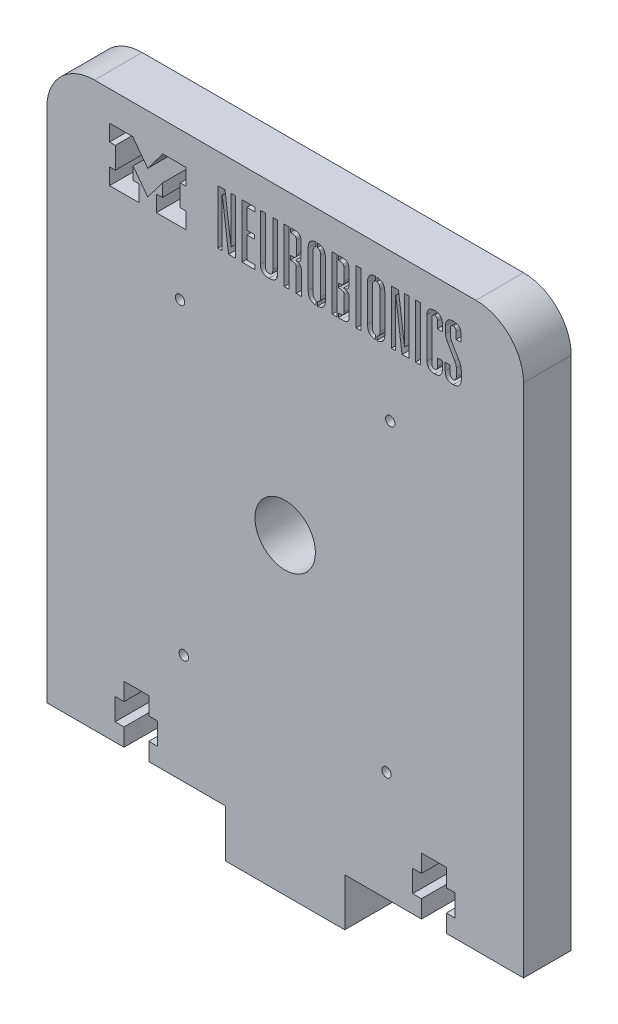
from build123d import *

# Parameters (mm, degrees)
SKETCH1_W             = 127
SKETCH1_H             = 150
BOSS_EXTRUDE1_DEPTH   = 12.7
CUT_EXTRUDE1_DEPTH    = 197.952506966
FILLET1_R             = 12.7
SKETCH11_W            = 31.75
SKETCH11_H            = 12.7
BOSS_EXTRUDE2_DEPTH   = 12.7
CUT_EXTRUDE9_DEPTH    = 197.952506966
SKETCH19_W            = 1.320165
SKETCH19_H            = 14.40446524
CUT_EXTRUDE10_DEPTH   = 197.952506966
SKETCH21_R            = 8.05
CUT_EXTRUDE11_DEPTH   = 197.952507113
M3X0_5_TAPPED_HOLE1_D = 2.5
FILLET2_R             = 0.25


with BuildPart() as part:
    # Sketch1 → Boss-Extrude1 (new body)
    with BuildSketch(Plane.XY):
        with Locations((63.5, 75)):
            Rectangle(SKETCH1_W, SKETCH1_H)
    extrude(amount=BOSS_EXTRUDE1_DEPTH)

    # Sketch2 → Cut-Extrude1 (cut, through all)
    with BuildSketch(Plane.XY.offset(12.7)):
        Polygon((20.574, 4.699), (20.574, 0), (27.178, 0), (27.178, 4.699), (29.5402, 4.699), (29.5402, 10.541), (27.178, 10.541), (27.178, 15.24), (20.574, 15.24), (20.574, 10.541), (18.2118, 10.541), (18.2118, 4.699), align=None)
        Polygon((99.822, 4.699), (99.822, 0), (106.426, 0), (106.426, 4.699), (108.7882, 4.699), (108.7882, 10.541), (106.426, 10.541), (106.426, 15.24), (99.822, 15.24), (99.822, 10.541), (97.4598, 10.541), (97.4598, 4.699), align=None)
    extrude(amount=-CUT_EXTRUDE1_DEPTH, mode=Mode.SUBTRACT)

    # Fillet1
    fillet1_edges = [part.edges().sort_by_distance(p)[0] for p in [
        (127, 150, 6.35),
        (0, 150, 6.35),
    ]]
    fillet(fillet1_edges, radius=FILLET1_R)

    # Sketch11 → Boss-Extrude2 (add)
    with BuildSketch(Plane.XZ):
        with Locations((63.5, 6.35)):
            Rectangle(SKETCH11_W, SKETCH11_H)
    extrude(amount=BOSS_EXTRUDE2_DEPTH)

    # Sketch20 → Cut-Extrude9 (cut, through all)
    with BuildSketch(Plane.XY.offset(12.7)):
        Polygon((22.97667018, 131.97336552), (24.604291259, 131.97336552), (24.604291259, 127.640619868), (16.714850296, 127.640619868), (16.714850296, 131.97336552), (18.254329992, 131.97336552), (18.254329992, 137.700621193), (16.714056676, 137.700621193), (16.714056676, 142.045085108), (22.890341603, 142.045085108), (26.901674355, 136.730226684), (30.913007108, 142.045085108), (37.089292035, 142.045085108), (37.089292035, 137.700621193), (35.549018719, 137.700621193), (35.549018719, 131.97336552), (37.088498415, 131.97336552), (37.088498415, 127.640619868), (29.199057452, 127.640619868), (29.199057452, 131.97336552), (30.826678531, 131.97336552), (30.826678531, 135.321098969), (26.901674355, 130.12062252), (22.97667018, 135.321098969), align=None)
    extrude(amount=-CUT_EXTRUDE9_DEPTH, mode=Mode.SUBTRACT)

    # Sketch19 → Cut-Extrude10 (cut, through all)
    with BuildSketch(Plane.XY.offset(12.7)):
        with BuildLine():
            Line((64.919332717, 135.678954152), (64.919332717, 134.564150108))
            Line((64.919332717, 134.564150108), (65.415267123, 134.564150108))
            add(Edge.make_bspline(
                [(66.456730818, 133.684040108), (66.456730818, 134.388128108), (66.031344123, 134.564150108), (65.415267123, 134.564150108)],
                knots=[0, 0, 0, 0, 1, 1, 1, 1], degree=3))
            Line((66.456730818, 133.684040108), (66.442061927, 133.684023484))
            Line((66.442061927, 133.684023484), (66.442061927, 127.640603244))
            Line((66.442061927, 127.640603244), (67.796402522, 127.640603244))
            Line((67.796402522, 127.640603244), (67.796402522, 133.801373244))
            add(Edge.make_bspline(
                [(66.300215522, 135.136207722), (67.238999913, 135.077535482), (67.796402522, 134.7988332), (67.796402522, 133.801373244)],
                knots=[0, 0, 0, 0, 1, 1, 1, 1], degree=3))
            Line((66.300215522, 135.136207722), (66.300215522, 135.180227108))
            add(Edge.make_bspline(
                [(67.737728717, 136.735086152), (67.737728717, 135.620282108), (67.312342022, 135.238899152), (66.300215522, 135.180227108)],
                knots=[0, 0, 0, 0, 1, 1, 1, 1], degree=3))
            Line((67.737728717, 136.735086152), (67.737728717, 140.387545586))
            add(Edge.make_bspline(
                [(65.698807413, 142.045085108), (66.960298022, 142.045085108), (67.737728717, 141.825060346), (67.737728717, 140.387545586)],
                knots=[0, 0, 0, 0, 1, 1, 1, 1], degree=3))
            Line((65.698807413, 142.045085108), (64.919332717, 142.045085108))
            Line((64.919332717, 142.045085108), (64.919332717, 140.930280868))
            Line((64.919332717, 140.930280868), (65.378467238, 140.930280868))
            add(Edge.make_bspline(
                [(66.493273629, 139.947490586), (66.493273629, 140.783592152), (66.053218629, 140.930280868), (65.378467238, 140.930280868)],
                knots=[0, 0, 0, 0, 1, 1, 1, 1], degree=3))
            Line((66.493273629, 139.947490586), (66.493273629, 136.720422346))
            add(Edge.make_bspline(
                [(65.510483738, 135.678954152), (66.126560738, 135.678954152), (66.493273629, 135.854976152), (66.493273629, 136.720422346)],
                knots=[0, 0, 0, 0, 1, 1, 1, 1], degree=3))
            Line((65.510483738, 135.678954152), (64.919332717, 135.678954152))
        make_face()
        Polygon((64.569332717, 140.93031325), (64.569332717, 142.045085108), (63.249167717, 142.045085108), (63.249167717, 127.640619868), (64.569332717, 127.640619868), align=None)
        Polygon((46.761773522, 140.44621763), (46.717770955, 140.44621763), (46.717770955, 127.640619868), (45.558959455, 127.640619868), (45.558959455, 142.045085108), (47.480533151, 142.045085108), (49.094067955, 129.723545108), (49.138070522, 129.723545108), (49.138070522, 142.045085108), (50.296882413, 142.045085108), (50.296882413, 127.640619868), (48.419314217, 127.640619868), align=None)
        with BuildLine():
            Line((58.217872413, 142.045085108), (58.217872413, 130.002247586))
            add(Edge.make_bspline(
                [(58.217872413, 130.002247586), (58.217872413, 128.960784868), (58.555247522, 128.65274363), (59.215330022, 128.65274363)],
                knots=[0, 0, 0, 0, 1, 1, 1, 1], degree=3))
            add(Edge.make_bspline(
                [(59.215330022, 128.65274363), (59.890081413, 128.65274363), (60.212788217, 128.975454346), (60.212788217, 130.002247586)],
                knots=[0, 0, 0, 0, 1, 1, 1, 1], degree=3))
            Line((60.212788217, 130.002247586), (60.212788217, 142.045085108))
            Line((60.212788217, 142.045085108), (61.518284913, 142.045085108))
            Line((61.518284913, 142.045085108), (61.518284913, 129.576861868))
            add(Edge.make_bspline(
                [(61.518284913, 129.576861868), (61.518284913, 127.977994586), (60.315467522, 127.523270108), (59.185993413, 127.523270108)],
                knots=[0, 0, 0, 0, 1, 1, 1, 1], degree=3))
            add(Edge.make_bspline(
                [(59.185993413, 127.523270108), (58.085855913, 127.523270108), (56.897707413, 127.977994586), (56.897707413, 129.576861868)],
                knots=[0, 0, 0, 0, 1, 1, 1, 1], degree=3))
            Line((56.897707413, 129.576861868), (56.897707413, 142.045085108))
            Line((56.897707413, 142.045085108), (58.217872413, 142.045085108))
        make_face()
        with BuildLine():
            Line((74.230211032, 139.727460153), (74.230211032, 129.958239152))
            add(Edge.make_bspline(
                [(74.230211032, 129.958239152), (74.230211032, 128.588188835), (73.727002155, 127.598938483), (72.105088423, 127.527419045)],
                knots=[0, 0, 0, 0, 0.962898501, 0.962898501, 0.962898501, 0.962898501], degree=3))
            Line((72.105088423, 127.527419045), (72.105088423, 128.649158115))
            add(Edge.make_bspline(
                [(72.105088423, 128.649158115), (72.774089716, 128.731143819), (72.910046032, 129.260484228), (72.910046032, 129.987578109)],
                knots=[0.082066912, 0.082066912, 0.082066912, 0.082066912, 1, 1, 1, 1], degree=3))
            Line((72.910046032, 129.987578109), (72.910046032, 139.683457587))
            add(Edge.make_bspline(
                [(72.910046032, 139.683457587), (72.910046032, 140.410551468), (72.774089716, 140.939891712), (72.105088423, 141.021877389)],
                knots=[0, 0, 0, 0, 0.917933088, 0.917933088, 0.917933088, 0.917933088], degree=3))
            Line((72.105088423, 141.021877389), (72.105088423, 142.158285932))
            add(Edge.make_bspline(
                [(72.105088423, 142.158285932), (73.727002155, 142.086766486), (74.230211032, 141.097515931), (74.230211032, 139.727460153)],
                knots=[0.037101499, 0.037101499, 0.037101499, 0.037101499, 1, 1, 1, 1], degree=3))
        make_face()
        Polygon((77.316259413, 134.564150108), (77.316259413, 128.755424108), (77.316259413, 127.640603244), (76.010762717, 127.640603244), (76.010762717, 142.045085108), (77.316259413, 142.045085108), (77.316259413, 140.930280868), (77.316259413, 135.678954152), align=None)
        Polygon((94.625086479, 127.640619868), (92.967546957, 140.44621763), (92.923527571, 140.44621763), (92.923527571, 127.640619868), (91.764715093, 127.640619868), (91.764715093, 142.045085108), (93.686287811, 142.045085108), (95.299824571, 129.723545108), (95.343843957, 129.723545108), (95.343843957, 142.045085108), (96.502656435, 142.045085108), (96.502656435, 127.640619868), align=None)
        with BuildLine():
            Line((104.056932957, 129.547523108), (104.056932957, 131.55710663))
            Line((104.056932957, 131.55710663), (105.377097957, 131.55710663))
            Line((105.377097957, 131.55710663), (105.377097957, 129.503520346))
            add(Edge.make_bspline(
                [(105.377097957, 129.503520346), (105.377097957, 128.286030152), (104.702348717, 127.50860063), (103.323511673, 127.50860063)],
                knots=[0, 0, 0, 0, 1, 1, 1, 1], degree=3))
            add(Edge.make_bspline(
                [(103.323511673, 127.50860063), (101.944668957, 127.50860063), (101.269919717, 128.286030152), (101.269919717, 129.503520346)],
                knots=[0, 0, 0, 0, 1, 1, 1, 1], degree=3))
            Line((101.269919717, 129.503520346), (101.269919717, 140.152851346))
            add(Edge.make_bspline(
                [(101.269919717, 140.152851346), (101.269919717, 141.370335868), (101.944668957, 142.147765586), (103.323511673, 142.147765586)],
                knots=[0, 0, 0, 0, 1, 1, 1, 1], degree=3))
            add(Edge.make_bspline(
                [(103.323511673, 142.147765586), (104.702348717, 142.147765586), (105.377097957, 141.370335868), (105.377097957, 140.152851346)],
                knots=[0, 0, 0, 0, 1, 1, 1, 1], degree=3))
            Line((105.377097957, 140.152851346), (105.377097957, 138.275281586))
            Line((105.377097957, 138.275281586), (104.056932957, 138.275281586))
            Line((104.056932957, 138.275281586), (104.056932957, 140.123512586))
            add(Edge.make_bspline(
                [(104.056932957, 140.123512586), (104.056932957, 140.739589586), (103.836908195, 141.047625152), (103.323511673, 141.047625152)],
                knots=[0, 0, 0, 0, 1, 1, 1, 1], degree=3))
            add(Edge.make_bspline(
                [(103.323511673, 141.047625152), (102.810109479, 141.047625152), (102.590084717, 140.754258868), (102.590084717, 140.123512586)],
                knots=[0, 0, 0, 0, 1, 1, 1, 1], degree=3))
            Line((102.590084717, 140.123512586), (102.590084717, 129.547523108))
            add(Edge.make_bspline(
                [(102.590084717, 129.547523108), (102.590084717, 128.931446108), (102.810109479, 128.623410346), (103.323511673, 128.623410346)],
                knots=[0, 0, 0, 0, 1, 1, 1, 1], degree=3))
            add(Edge.make_bspline(
                [(103.323511673, 128.623410346), (103.836908195, 128.623410346), (104.056932957, 128.91677663), (104.056932957, 129.547523108)],
                knots=[0, 0, 0, 0, 1, 1, 1, 1], degree=3))
        make_face()
        with BuildLine():
            Line((107.533370195, 140.064840346), (107.533370195, 138.553983868))
            add(Edge.make_bspline(
                [(107.533370195, 138.553983868), (107.533370195, 138.099259586), (107.606711717, 137.62986563), (107.826736479, 137.263152152)],
                knots=[0, 0, 0, 0, 1, 1, 1, 1], degree=3))
            Line((107.826736479, 137.263152152), (109.924336673, 133.66937063))
            add(Edge.make_bspline(
                [(109.924336673, 133.66937063), (110.217702957, 133.170643586), (110.408394435, 132.554566586), (110.408394435, 131.90915063)],
                knots=[0, 0, 0, 0, 1, 1, 1, 1], degree=3))
            Line((110.408394435, 131.90915063), (110.408394435, 129.635534108))
            add(Edge.make_bspline(
                [(110.408394435, 129.635534108), (110.408394435, 128.286030152), (109.616295435, 127.523270108), (108.296130435, 127.523270108)],
                knots=[0, 0, 0, 0, 1, 1, 1, 1], degree=3))
            add(Edge.make_bspline(
                [(108.296130435, 127.523270108), (106.843951673, 127.523270108), (106.139863673, 128.183355346), (106.139863673, 129.635534108)],
                knots=[0, 0, 0, 0, 1, 1, 1, 1], degree=3))
            Line((106.139863673, 129.635534108), (106.139863673, 131.615784346))
            Line((106.139863673, 131.615784346), (107.460028673, 131.615784346))
            Line((107.460028673, 131.615784346), (107.460028673, 129.723545108))
            add(Edge.make_bspline(
                [(107.460028673, 129.723545108), (107.460028673, 129.048795868), (107.724061673, 128.65274363), (108.296130435, 128.65274363)],
                knots=[0, 0, 0, 0, 1, 1, 1, 1], degree=3))
            add(Edge.make_bspline(
                [(108.296130435, 128.65274363), (108.838865717, 128.65274363), (109.088229435, 129.048795868), (109.088229435, 129.723545108)],
                knots=[0, 0, 0, 0, 1, 1, 1, 1], degree=3))
            Line((109.088229435, 129.723545108), (109.088229435, 131.73312863))
            add(Edge.make_bspline(
                [(109.088229435, 131.73312863), (109.088229435, 132.231861346), (108.985548957, 132.61323863), (108.706846479, 133.111971346)],
                knots=[0, 0, 0, 0, 1, 1, 1, 1], degree=3))
            Line((108.706846479, 133.111971346), (106.770604479, 136.48572263))
            add(Edge.make_bspline(
                [(106.770604479, 136.48572263), (106.418560479, 137.10179963), (106.213205195, 137.585862868), (106.213205195, 138.319284152)],
                knots=[0, 0, 0, 0, 1, 1, 1, 1], degree=3))
            Line((106.213205195, 138.319284152), (106.213205195, 140.050170868))
            add(Edge.make_bspline(
                [(106.213205195, 140.050170868), (106.213205195, 141.473016346), (106.946626479, 142.162434868), (108.281460957, 142.162434868)],
                knots=[0, 0, 0, 0, 1, 1, 1, 1], degree=3))
            add(Edge.make_bspline(
                [(108.281460957, 142.162434868), (109.762978479, 142.162434868), (110.349722195, 141.458346868), (110.349722195, 140.152851346)],
                knots=[0, 0, 0, 0, 1, 1, 1, 1], degree=3))
            Line((110.349722195, 140.152851346), (110.349722195, 138.319284152))
            Line((110.349722195, 138.319284152), (109.029557195, 138.319284152))
            Line((109.029557195, 138.319284152), (109.029557195, 140.064840346))
            Line((109.029557195, 140.064840346), (109.058890479, 140.064840346))
            add(Edge.make_bspline(
                [(109.058890479, 140.064840346), (109.058890479, 140.62223963), (108.912207435, 141.047625152), (108.296130435, 141.047625152)],
                knots=[0, 0, 0, 0, 1, 1, 1, 1], degree=3))
            add(Edge.make_bspline(
                [(108.296130435, 141.047625152), (107.680053435, 141.047625152), (107.533370195, 140.62223963), (107.533370195, 140.064840346)],
                knots=[0, 0, 0, 0, 1, 1, 1, 1], degree=3))
        make_face()
        with BuildLine():
            Line((85.442609195, 129.958239152), (85.442609195, 139.727460153))
            add(Edge.make_bspline(
                [(85.442609195, 139.727460153), (85.442609195, 141.097515797), (85.945819062, 142.086766292), (87.567728479, 142.158285911)],
                knots=[0, 0, 0, 0, 0.962898407, 0.962898407, 0.962898407, 0.962898407], degree=3))
            Line((87.567728479, 142.158285911), (87.567728479, 141.021877309))
            add(Edge.make_bspline(
                [(87.567728479, 141.021877309), (86.898729931, 140.939891377), (86.762774195, 140.410551237), (86.762774195, 139.683457585)],
                knots=[0.0820672, 0.0820672, 0.0820672, 0.0820672, 1, 1, 1, 1], degree=3))
            Line((86.762774195, 139.683457585), (86.762774195, 129.987578107))
            add(Edge.make_bspline(
                [(86.762774195, 129.987578107), (86.762774195, 129.260484455), (86.898729931, 128.731144151), (87.567728479, 128.649158191)],
                knots=[0, 0, 0, 0, 0.917932799, 0.917932799, 0.917932799, 0.917932799], degree=3))
            Line((87.567728479, 128.649158191), (87.567728479, 127.527419066))
            add(Edge.make_bspline(
                [(87.567728479, 127.527419066), (85.945819062, 127.598938677), (85.442609195, 128.58818897), (85.442609195, 129.958239152)],
                knots=[0.037101593, 0.037101593, 0.037101593, 0.037101593, 1, 1, 1, 1], degree=3))
        make_face()
        with Locations((98.849617217, 134.842852488)):
            Rectangle(SKETCH19_W, SKETCH19_H)
        Polygon((53.318593022, 135.678954152), (55.386851522, 135.678954152), (55.386851522, 134.564150108), (53.318593022, 134.564150108), (53.318593022, 128.755424108), (55.489531413, 128.755424108), (55.489531413, 127.640619868), (51.998428022, 127.640619868), (51.998428022, 142.045085108), (55.489531413, 142.045085108), (55.489531413, 140.930280868), (53.318593022, 140.930280868), align=None)
        with BuildLine():
            Line((80.499323717, 140.387545586), (80.499323717, 136.735086152))
            add(Edge.make_bspline(
                [(80.499323717, 136.735086152), (80.499323717, 135.620282108), (80.073938195, 135.224235346), (79.061810522, 135.180227108)],
                knots=[0, 0, 0, 0, 1, 1, 1, 1], degree=3))
            Line((79.061810522, 135.180227108), (79.061810522, 135.136207722))
            add(Edge.make_bspline(
                [(79.061810522, 135.136207722), (79.985927195, 135.092188336), (80.557995957, 134.7988332), (80.557995957, 133.801373244)],
                knots=[0, 0, 0, 0, 1, 1, 1, 1], degree=3))
            Line((80.557995957, 133.801373244), (80.557995957, 129.298142962))
            add(Edge.make_bspline(
                [(80.557995957, 129.298142962), (80.557995957, 127.860633482), (79.780566435, 127.640603244), (78.460402413, 127.640603244)],
                knots=[0, 0, 0, 0, 1, 1, 1, 1], degree=3))
            Line((78.460402413, 127.640603244), (77.666259413, 127.640603244))
            Line((77.666259413, 127.640603244), (77.666259413, 128.755424108))
            Line((77.666259413, 128.755424108), (78.088026717, 128.755424108))
            add(Edge.make_bspline(
                [(78.088026717, 128.755424108), (78.762777522, 128.755424108), (79.202832522, 128.902107152), (79.202832522, 129.738214586)],
                knots=[0, 0, 0, 0, 1, 1, 1, 1], degree=3))
            Line((79.202832522, 129.738214586), (79.202832522, 133.684040108))
            add(Edge.make_bspline(
                [(79.202832522, 133.684040108), (79.202832522, 134.388128108), (78.777446413, 134.564150108), (78.161369413, 134.564150108)],
                knots=[0, 0, 0, 0, 1, 1, 1, 1], degree=3))
            Line((78.161369413, 134.564150108), (77.666259413, 134.564150108))
            Line((77.666259413, 134.564150108), (77.666259413, 135.678954152))
            Line((77.666259413, 135.678954152), (78.146701108, 135.678954152))
            add(Edge.make_bspline(
                [(78.146701108, 135.678954152), (78.762778108, 135.678954152), (79.129490413, 135.854976152), (79.129490413, 136.720422346)],
                knots=[0, 0, 0, 0, 1, 1, 1, 1], degree=3))
            Line((79.129490413, 136.720422346), (79.129490413, 139.947490586))
            add(Edge.make_bspline(
                [(79.129490413, 139.947490586), (79.129490413, 140.783592152), (78.689435413, 140.930280868), (78.014684608, 140.930280868)],
                knots=[0, 0, 0, 0, 1, 1, 1, 1], degree=3))
            Line((78.014684608, 140.930280868), (77.666259413, 140.930280868))
            Line((77.666259413, 140.930280868), (77.666259413, 142.045085108))
            Line((77.666259413, 142.045085108), (78.460402413, 142.045085108))
            add(Edge.make_bspline(
                [(78.460402413, 142.045085108), (79.721893022, 142.045085108), (80.499323717, 141.825060346), (80.499323717, 140.387545586)],
                knots=[0, 0, 0, 0, 1, 1, 1, 1], degree=3))
        make_face()
        with BuildLine():
            Line((88.722688435, 129.987578107), (88.722688435, 139.683457585))
            add(Edge.make_bspline(
                [(88.722688435, 139.683457585), (88.722688435, 140.410551689), (88.586732366, 140.939892034), (87.917728479, 141.021877462)],
                knots=[0, 0, 0, 0, 0.917933369, 0.917933369, 0.917933369, 0.917933369], degree=3))
            Line((87.917728479, 141.021877462), (87.917728479, 142.158285937))
            add(Edge.make_bspline(
                [(87.917728479, 142.158285937), (89.539643443, 142.086766539), (90.042853435, 141.097515968), (90.042853435, 139.727460153)],
                knots=[0.037101473, 0.037101473, 0.037101473, 0.037101473, 1, 1, 1, 1], degree=3))
            Line((90.042853435, 139.727460153), (90.042853435, 129.958239152))
            add(Edge.make_bspline(
                [(90.042853435, 129.958239152), (90.042853435, 128.588188799), (89.539643443, 127.59893843), (87.917728479, 127.527419039)],
                knots=[0, 0, 0, 0, 0.962898527, 0.962898527, 0.962898527, 0.962898527], degree=3))
            Line((87.917728479, 127.527419039), (87.917728479, 128.649158038))
            add(Edge.make_bspline(
                [(87.917728479, 128.649158038), (88.586732365, 128.731143494), (88.722688435, 129.260484004), (88.722688435, 129.987578107)],
                knots=[0.082066631, 0.082066631, 0.082066631, 0.082066631, 1, 1, 1, 1], degree=3))
        make_face()
        with Locations((83.036976173, 134.842852488)):
            Rectangle(SKETCH19_W, SKETCH19_H)
        with BuildLine():
            Line((70.950130228, 139.683457587), (70.950130228, 129.98757811))
            add(Edge.make_bspline(
                [(70.950130228, 129.98757811), (70.950130228, 129.260484224), (71.086087039, 128.731143814), (71.755088423, 128.649158115)],
                knots=[0, 0, 0, 0, 0.917933093, 0.917933093, 0.917933093, 0.917933093], degree=3))
            Line((71.755088423, 128.649158115), (71.755088423, 127.527419042))
            add(Edge.make_bspline(
                [(71.755088423, 127.527419042), (70.133174118, 127.598938457), (69.629965228, 128.588188818), (69.629965228, 129.958239152)],
                knots=[0.037101486, 0.037101486, 0.037101486, 0.037101486, 1, 1, 1, 1], degree=3))
            Line((69.629965228, 129.958239152), (69.629965217, 139.727460152))
            add(Edge.make_bspline(
                [(69.629965217, 139.727460152), (69.629965217, 141.097515951), (70.13317411, 142.086766515), (71.755088423, 142.158285934)],
                knots=[0, 0, 0, 0, 0.962898516, 0.962898516, 0.962898516, 0.962898516], degree=3))
            Line((71.755088423, 142.158285934), (71.755088423, 141.02187739))
            add(Edge.make_bspline(
                [(71.755088423, 141.02187739), (71.086087039, 140.939891718), (70.950130228, 140.410551472), (70.950130228, 139.683457587)],
                knots=[0.082066907, 0.082066907, 0.082066907, 0.082066907, 1, 1, 1, 1], degree=3))
        make_face()
    extrude(amount=-CUT_EXTRUDE10_DEPTH, mode=Mode.SUBTRACT)

    # Sketch21 → Cut-Extrude11 (cut, through all)
    with BuildSketch(Plane.XY.offset(12.7)):
        with Locations((63.5, 70.3825868)):
            Circle(SKETCH21_R)
    extrude(amount=-CUT_EXTRUDE11_DEPTH, mode=Mode.SUBTRACT)

    # M3x0.5 Tapped Hole1 (through all)
    with Locations(Plane.XY.offset(12.7)):
        with Locations((35.50000012, 110.720694002), (36.5, 29.21)):
            m3x0_5_tapped_hole1 = Hole(M3X0_5_TAPPED_HOLE1_D / 2)

    # Mirror3: M3x0.5 Tapped Hole1 across plane
    add(m3x0_5_tapped_hole1.mirror(Plane(origin=(63.5, 0, 0), x_dir=(0, 0, 1), z_dir=(1, 0, 0))), mode=Mode.SUBTRACT)

    # Fillet2
    fillet2_edges = [part.edges().sort_by_distance(p)[0] for p in [
        (24.604291259, 131.97336552, 6.35),
        (29.199057452, 131.97336552, 6.35),
    ]]
    fillet(fillet2_edges, radius=FILLET2_R)


solid = part.part
